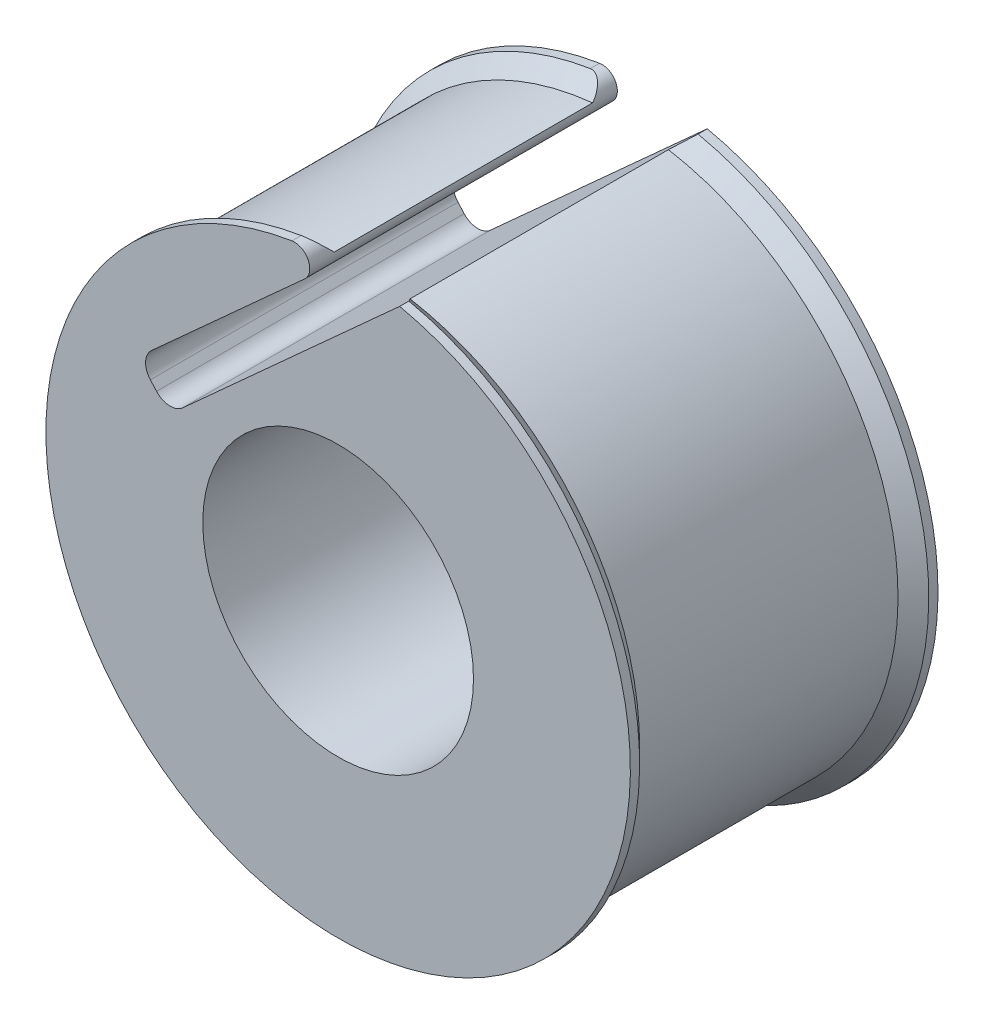
from build123d import *

# Parameters (mm, degrees)
SKETCH1_R           = 9.5
SKETCH1_R_2         = 4.4
BOSS_EXTRUDE1_DEPTH = 5
CUT_EXTRUDE1_DEPTH  = 17.748134224444225
SKETCH3_R           = 9.5
SKETCH3_R_2         = 9
CUT_EXTRUDE2_DEPTH  = 4
CHAMFER1_SIZE       = 0.7
FILLET1_R           = 0.5
FILLET2_R           = 0.6


with BuildPart() as part:
    # Sketch1 → Boss-Extrude1 (new, symmetric)
    with BuildSketch(Plane.XY):
        Circle(SKETCH1_R)
        Circle(SKETCH1_R_2, mode=Mode.SUBTRACT)
    extrude(amount=BOSS_EXTRUDE1_DEPTH, both=True)

    # Sketch2 → Cut-Extrude1 (cut, through all)
    with BuildSketch(Plane.XY.offset(5)):
        with BuildLine():
            Line((0, 9.5), (-6.506462158581922, 3.612220267457224))
            Line((-6.506462158581922, 3.612220267457224), (-5.500000000000001, 2.4999999999999996))
            Line((-5.500000000000001, 2.4999999999999996), (2.000217039706271, 9.287041067749655))
            ThreePointArc((2.000217039706271, 9.287041067749655), (1.0057608702813652, 9.446610242399696), (0, 9.5))
        make_face()
    extrude(amount=-CUT_EXTRUDE1_DEPTH, mode=Mode.SUBTRACT)

    # Sketch3 → Cut-Extrude2 (cut, symmetric)
    with BuildSketch(Plane.XY):
        Circle(SKETCH3_R)
        Circle(SKETCH3_R_2, mode=Mode.SUBTRACT)
    extrude(amount=CUT_EXTRUDE2_DEPTH, both=True, mode=Mode.SUBTRACT)

    # Chamfer1
    # the kernel refuses this chamfer: 0.7 mm, written as the material it takes off along each edge
    with BuildSketch(Plane(origin=(0, 0, 4), x_dir=(0.10274511100346817, 0.9947077169525151, 0), z_dir=(0.9947077169525151, -0.10274511100346817, 0))) as chamfer1_piece_1_section:
        Polygon((9.5, CHAMFER1_SIZE), (9.5 - CHAMFER1_SIZE, 0), (9.5, 0), align=None)
    chamfer1_piece_1 = revolve(axis=Axis((0, 0, 4), (0, 0, 1)), revolution_arc=359.64, mode=Mode.PRIVATE)
    chamfer1_piece_1 = chamfer1_piece_1 - Plane(origin=(0, 0, 4.439831857806262), x_dir=(1, 0, 0), z_dir=(0, 0, -1)) * Cylinder(9, 38, mode=Mode.PRIVATE)
    add(chamfer1_piece_1, mode=Mode.SUBTRACT)
    with BuildSketch(Plane(origin=(0, 0, -4), x_dir=(0.10274511100346817, 0.9947077169525151, 0), z_dir=(0.9947077169525151, -0.10274511100346817, 0))) as chamfer1_piece_2_section:
        Polygon((9.5 - CHAMFER1_SIZE, 0), (9.5, -CHAMFER1_SIZE), (9.5, 0), align=None)
    chamfer1_piece_2 = revolve(axis=Axis((0, 0, -4), (0, 0, 1)), revolution_arc=359.64, mode=Mode.PRIVATE)
    chamfer1_piece_2 = chamfer1_piece_2 - Plane(origin=(0, 0, -4.439831857806264), x_dir=(1, 0, 0), z_dir=(0, 0, -1)) * Cylinder(9, 38, mode=Mode.PRIVATE)
    add(chamfer1_piece_2, mode=Mode.SUBTRACT)

    # Fillet1
    fillet1_edges = [part.edges().sort_by_distance(p)[0] for p in [
        (3e-17, 9.5, 4.85),
    ]]
    fillet(fillet1_edges, radius=FILLET1_R)

    # Fillet2
    fillet2_edges = [part.edges().sort_by_distance(p)[0] for p in [
        (-5.500000000000001, 2.4999999999999996, 0),
        (-6.506462158581922, 3.612220267457224, 0),
    ]]
    fillet(fillet2_edges, radius=FILLET2_R)


solid = part.part
